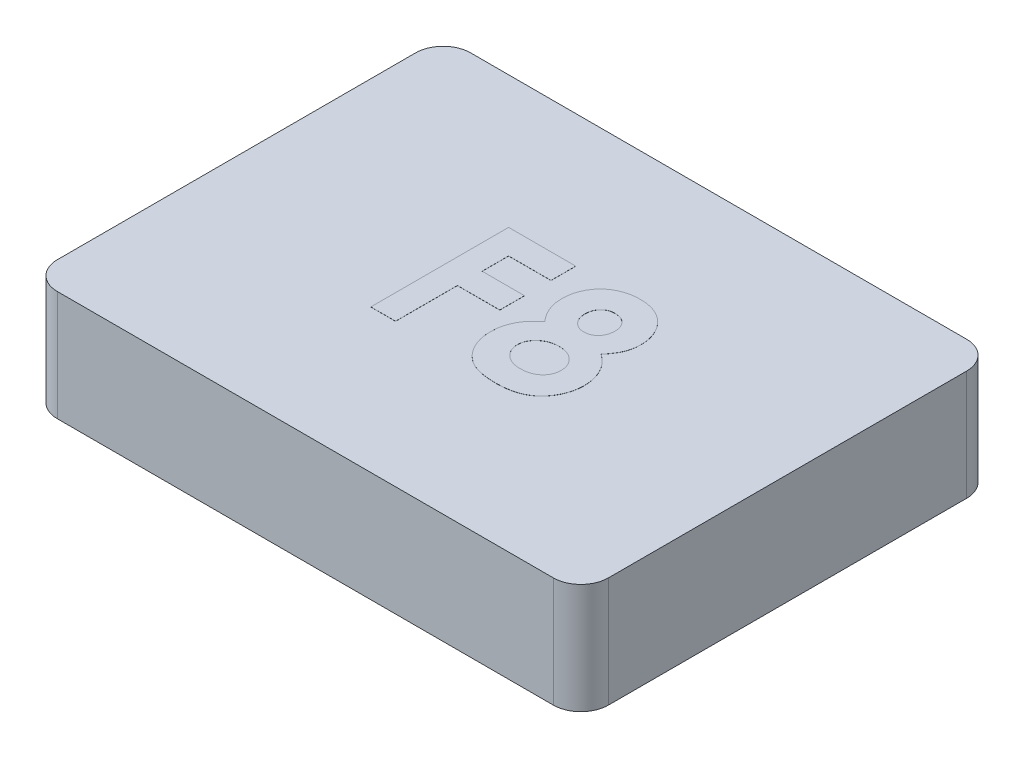
from build123d import *

# Parameters (mm, degrees)
SKETCH1_W           = 12.7
SKETCH1_H           = 9.525
BOSS_EXTRUDE1_DEPTH = 2.54
FILLET1_R           = 0.635
SHELL1_START        = 0.635
SHELL1_OUTLINE_W    = 1.905
SHELL1_OUTLINE_H    = 8.255
SHELL1_DEPTH        = 11.43
SKETCH2_R           = 2.54
BOSS_EXTRUDE2_DEPTH = 1.905
BOSS_EXTRUDE3_DEPTH = 0.00254


# Read off the part's stored shape, not the designer's step: Shell1
with BuildPart() as part:
    # Sketch1 → Boss-Extrude1 (new body)
    with BuildSketch(Plane(origin=(0, 0, 0), x_dir=(1, 0, 0), z_dir=(0, 1, 0))):
        with Locations((6.35, 4.7625)):
            Rectangle(SKETCH1_W, SKETCH1_H)
    extrude(amount=BOSS_EXTRUDE1_DEPTH)

    # Fillet1
    fillet1_edges = [part.edges().sort_by_distance(p)[0] for p in [
        (0, 1.27, -9.525),
        (12.7, 1.27, -9.525),
        (12.7, 1.27, 0),
        (0, 1.27, 0),
    ]]
    fillet(fillet1_edges, radius=FILLET1_R)

    # Shell1 outline → Shell1 (cut)
    with BuildSketch(Plane.YZ.offset(SHELL1_START)):
        with Locations((0.9525, -4.7625)):
            Rectangle(SHELL1_OUTLINE_W, SHELL1_OUTLINE_H)
    extrude(amount=SHELL1_DEPTH, mode=Mode.SUBTRACT)

    # Sketch2 → Boss-Extrude2 (add)
    with BuildSketch(Plane(origin=(0, 1.905, 0), x_dir=(-1, 0, 0), z_dir=(0, -1, 0))):
        with Locations(Location((-6.35, 4.7625, 0), (0, 0, 270))):
            Circle(SKETCH2_R)
    extrude(amount=BOSS_EXTRUDE2_DEPTH)

    # Sketch3 → Boss-Extrude3 (add)
    # profile 1 of 2: a face of its own
    with BuildSketch(Plane(origin=(0, 2.54, 0), x_dir=(1, 0, 0), z_dir=(0, 1, 0))):
        Polygon((4.557346154, 6.477), (6.104141026, 6.477), (6.104141026, 5.907128205), (5.127217949, 5.907128205), (5.127217949, 5.296551282), (6.104141026, 5.296551282), (6.104141026, 4.726679487), (5.127217949, 4.726679487), (5.127217949, 3.302), (4.557346154, 3.302), align=None)
    # profile 2 of 2: a face of its own
    with BuildSketch(Plane(origin=(0, 2.54, 0), x_dir=(1, 0, 0), z_dir=(0, 1, 0))):
        with BuildLine():
            add(Edge.make_bspline(
                [(8.152117788, 5.011615385), (8.185411662, 4.987826012), (8.251313882, 4.940737096), (8.338346608, 4.856375541), (8.413312127, 4.762269248), (8.47542322, 4.658995446), (8.525184754, 4.549092633), (8.560806462, 4.433735537), (8.583432962, 4.313941637), (8.585904452, 4.232382608), (8.587153846, 4.191152644)],
                knots=[0, 0, 0, 0, 1.013736912, 2.006600758, 2.994453809, 3.989973287, 4.987781207, 5.978959008, 6.978317308, 8, 8, 8, 8], degree=3))
            add(Edge.make_bspline(
                [(8.587153846, 4.191152644), (8.585646547, 4.14650785), (8.582657011, 4.057960631), (8.556225525, 3.928106148), (8.513790835, 3.80335344), (8.455795549, 3.685079461), (8.383080127, 3.576959714), (8.29832354, 3.481242926), (8.201418946, 3.400428905), (8.111198023, 3.345597114), (8.033541724, 3.309173392), (7.970873771, 3.285862941), (7.904700533, 3.26534135), (7.834549805, 3.248945961), (7.760434345, 3.236146669), (7.682459924, 3.22769404), (7.600575213, 3.221549495), (7.544733302, 3.220915055), (7.51610016, 3.220589744)],
                knots=[0, 0, 0, 0, 1.313679292, 2.605514271, 3.884962679, 5.186178731, 6.472827995, 7.711026938, 8.938935107, 10.174644318, 10.808706728, 11.462743532, 12.142127587, 12.847854939, 13.582806024, 14.355735269, 15.156897313, 16, 16, 16, 16], degree=3))
            add(Edge.make_bspline(
                [(7.51610016, 3.220589744), (7.485565755, 3.22100393), (7.425938082, 3.221812753), (7.338894962, 3.226703329), (7.256787585, 3.235719654), (7.179443718, 3.247588948), (7.106937773, 3.263295464), (7.039267602, 3.283210467), (6.976269809, 3.305885913), (6.899157201, 3.340411225), (6.811031474, 3.394329893), (6.7157835, 3.473292228), (6.632180148, 3.567338836), (6.559494951, 3.673829843), (6.502201739, 3.792110116), (6.459596799, 3.918467223), (6.434365649, 4.052558751), (6.431328101, 4.144404855), (6.429782051, 4.191152644)],
                knots=[0, 0, 0, 0, 0.886964665, 1.7320671, 2.531131818, 3.285397207, 4.004107883, 4.684213108, 5.332925796, 5.947568694, 7.135706876, 8.320776993, 9.52873045, 10.778999824, 12.05415135, 13.333578234, 14.642845846, 16, 16, 16, 16], degree=3))
            add(Edge.make_bspline(
                [(6.429782051, 4.191152644), (6.431194882, 4.2319324), (6.433971265, 4.312069557), (6.453858873, 4.429495836), (6.487960077, 4.540829844), (6.534752236, 4.646846641), (6.595089932, 4.747558024), (6.669329964, 4.842222955), (6.756531047, 4.931695445), (6.822657257, 4.984533521), (6.85654988, 5.011615385)],
                knots=[0, 0, 0, 0, 1.01821053, 2.000906977, 2.963938143, 3.919209931, 4.888045165, 5.887808425, 6.917407893, 8, 8, 8, 8], degree=3))
            add(Edge.make_bspline(
                [(6.85654988, 5.011615385), (6.835538251, 5.035849224), (6.794172682, 5.083558356), (6.740645229, 5.160342401), (6.695550604, 5.239506832), (6.65726312, 5.320409188), (6.628960036, 5.404442406), (6.60755638, 5.49028531), (6.595450493, 5.578812445), (6.593558306, 5.638482365), (6.592602564, 5.668621595)],
                knots=[0, 0, 0, 0, 1.061529281, 2.089831458, 3.092927091, 4.075998741, 5.048384512, 6.024008542, 7.00192825, 8, 8, 8, 8], degree=3))
            add(Edge.make_bspline(
                [(6.592602564, 5.668621595), (6.593869733, 5.709421227), (6.596369807, 5.789917329), (6.618512824, 5.907621637), (6.655275609, 6.019464189), (6.705288249, 6.125117526), (6.768796529, 6.222279049), (6.844258115, 6.309411214), (6.932733848, 6.383322406), (7.030933554, 6.44674147), (7.139349456, 6.497184406), (7.256952915, 6.532480594), (7.382323851, 6.554824943), (7.468725758, 6.557196971), (7.512920072, 6.558410256)],
                knots=[0, 0, 0, 0, 1.022455555, 2.017265428, 2.990720743, 3.968117071, 4.939886797, 5.893155559, 6.847550415, 7.820889576, 8.817530429, 9.83499769, 10.892607882, 12, 12, 12, 12], degree=3))
            add(Edge.make_bspline(
                [(7.512920072, 6.558410256), (7.556477872, 6.557194985), (7.641406462, 6.554825462), (7.764574172, 6.532629167), (7.879636197, 6.496546749), (7.985641059, 6.445038738), (8.082825189, 6.381497441), (8.16979721, 6.305012731), (8.245021995, 6.215710397), (8.309057434, 6.116035335), (8.360083839, 6.008649897), (8.39780748, 5.896033972), (8.419627279, 5.779072732), (8.422758376, 5.699661569), (8.424333333, 5.659717348)],
                knots=[0, 0, 0, 0, 1.094655142, 2.134348324, 3.136019022, 4.118575226, 5.088726318, 6.048298823, 7.020513804, 8.015920439, 9.020015034, 10.003048569, 10.995523219, 12, 12, 12, 12], degree=3))
            add(Edge.make_bspline(
                [(8.424333333, 5.659717348), (8.423574638, 5.631486932), (8.422085756, 5.576086853), (8.411077263, 5.494466901), (8.392540312, 5.416152447), (8.366695604, 5.339250953), (8.330762638, 5.261672577), (8.282136981, 5.181930777), (8.222990253, 5.096712264), (8.176539373, 5.040938489), (8.152117788, 5.011615385)],
                knots=[0, 0, 0, 0, 0.940746401, 1.846144481, 2.739104268, 3.619506754, 4.545839139, 5.581956076, 6.728711598, 8, 8, 8, 8], degree=3))
        make_face()
        with BuildLine():
            add(Edge.make_bspline(
                [(7.498927684, 5.988538462), (7.475464872, 5.987407337), (7.42982452, 5.985207049), (7.36470108, 5.965347019), (7.306152984, 5.932864527), (7.255516705, 5.888162225), (7.213992318, 5.833922679), (7.183474174, 5.771563237), (7.165376554, 5.701853484), (7.163460569, 5.653041394), (7.162474359, 5.627916466)],
                knots=[0, 0, 0, 0, 1.018099191, 1.980427864, 2.929421084, 3.909248076, 4.895556904, 5.880788387, 6.909183412, 8, 8, 8, 8], degree=3))
            add(Edge.make_bspline(
                [(7.162474359, 5.627916466), (7.16369263, 5.602576967), (7.166071422, 5.553099152), (7.184777948, 5.482050049), (7.216663739, 5.417659356), (7.260442714, 5.361271984), (7.313641259, 5.315216409), (7.373207321, 5.280041724), (7.439801498, 5.259961409), (7.486078061, 5.257238447), (7.509739984, 5.255846154)],
                knots=[0, 0, 0, 0, 1.07118507, 2.091592095, 3.082435519, 4.092579768, 5.090825648, 6.043203473, 6.999459622, 8, 8, 8, 8], degree=3))
            add(Edge.make_bspline(
                [(7.509739984, 5.255846154), (7.533849248, 5.256924942), (7.580818619, 5.259026624), (7.647579073, 5.279627967), (7.70772171, 5.312575617), (7.759224994, 5.359156306), (7.801885534, 5.415564099), (7.83295422, 5.481080076), (7.850836233, 5.554473276), (7.853223545, 5.605768386), (7.854461538, 5.63236859)],
                knots=[0, 0, 0, 0, 1.008803858, 1.965339183, 2.900766489, 3.864508618, 4.855158575, 5.849593072, 6.884859315, 8, 8, 8, 8], degree=3))
            add(Edge.make_bspline(
                [(7.854461538, 5.63236859), (7.853192229, 5.657476908), (7.85073743, 5.706035512), (7.833135579, 5.775749787), (7.800808899, 5.837135947), (7.758335813, 5.891038677), (7.705085945, 5.934507876), (7.643266749, 5.966475387), (7.573333435, 5.985016853), (7.524266689, 5.987339172), (7.498927684, 5.988538462)],
                knots=[0, 0, 0, 0, 1.065910571, 2.061433587, 3.023559535, 3.990682701, 4.956464619, 5.918590567, 6.925120432, 8, 8, 8, 8], degree=3))
        make_face(mode=Mode.SUBTRACT)
        with BuildLine():
            add(Edge.make_bspline(
                [(7.517372196, 4.685974359), (7.499542234, 4.685678266), (7.464399604, 4.68509467), (7.41273705, 4.678364936), (7.36316152, 4.668335968), (7.31573452, 4.654501289), (7.270695649, 4.635641141), (7.227663127, 4.612904884), (7.186785568, 4.586062683), (7.148669301, 4.555601858), (7.114221103, 4.522168201), (7.083169186, 4.48729798), (7.057788628, 4.450089706), (7.036652674, 4.411780194), (7.019669815, 4.372065862), (7.008442862, 4.330292696), (7.001214276, 4.287016998), (7.00017705, 4.257539347), (6.999653846, 4.242670072)],
                knots=[0, 0, 0, 0, 1.129580664, 2.226389355, 3.296443603, 4.333934503, 5.352185725, 6.386189251, 7.41493955, 8.447544828, 9.47401038, 10.455044306, 11.4018853, 12.322125673, 13.225630306, 14.132028716, 15.057747923, 16, 16, 16, 16], degree=3))
            add(Edge.make_bspline(
                [(6.999653846, 4.242670072), (6.999903214, 4.227162887), (7.000397805, 4.196406304), (7.007867902, 4.151514587), (7.018623522, 4.108219609), (7.033730134, 4.066926636), (7.053932358, 4.027659711), (7.07805418, 3.990037072), (7.106936718, 3.954322538), (7.139796832, 3.920707595), (7.176583584, 3.890380917), (7.216231641, 3.863662584), (7.258217342, 3.840106335), (7.303801068, 3.823140191), (7.351294672, 3.807611286), (7.401970524, 3.798190273), (7.455275128, 3.79125803), (7.491694264, 3.790731586), (7.510376002, 3.790461538)],
                knots=[0, 0, 0, 0, 0.973817353, 1.931446211, 2.852767904, 3.776304432, 4.688323523, 5.623710549, 6.581246645, 7.570897993, 8.57436511, 9.572506873, 10.574556662, 11.591826551, 12.624694332, 13.712108235, 14.826391851, 16, 16, 16, 16], degree=3))
            add(Edge.make_bspline(
                [(7.510376002, 3.790461538), (7.529260459, 3.790803842), (7.566060287, 3.791470882), (7.619854235, 3.797366257), (7.670733762, 3.806720502), (7.718638096, 3.820099252), (7.763748388, 3.837237963), (7.805459521, 3.859052151), (7.844723831, 3.883773696), (7.880279555, 3.912655854), (7.912744552, 3.944131378), (7.940717704, 3.978625875), (7.964502966, 4.015030128), (7.983688371, 4.053737483), (7.999169271, 4.094565228), (8.009788196, 4.137920457), (8.016377621, 4.183315958), (8.016977338, 4.214238245), (8.017282051, 4.22994972)],
                knots=[0, 0, 0, 0, 1.200705402, 2.339794563, 3.437264955, 4.487414319, 5.499029866, 6.500076882, 7.476298407, 8.444948224, 9.407950986, 10.347155707, 11.263432813, 12.167927724, 13.089546445, 14.03463663, 15.00140776, 16, 16, 16, 16], degree=3))
            add(Edge.make_bspline(
                [(8.017282051, 4.22994972), (8.016700229, 4.245866599), (8.015562967, 4.276978582), (8.009340037, 4.322922743), (7.997666456, 4.366478525), (7.982394002, 4.408656097), (7.962078131, 4.448582665), (7.936856417, 4.486173963), (7.908147916, 4.522361173), (7.874594022, 4.555533371), (7.837908056, 4.585864551), (7.798861692, 4.612886303), (7.757575198, 4.635771234), (7.713935642, 4.654478529), (7.667783575, 4.668343167), (7.619471139, 4.678364584), (7.569077584, 4.685096176), (7.534778761, 4.68567872), (7.517372196, 4.685974359)],
                knots=[0, 0, 0, 0, 1.011708178, 1.977538892, 2.938094892, 3.871441737, 4.823268678, 5.775953079, 6.743660653, 7.753304209, 8.767430709, 9.76505158, 10.765940967, 11.761741361, 12.775867861, 13.822051386, 14.89469657, 16, 16, 16, 16], degree=3))
        make_face(mode=Mode.SUBTRACT)
    extrude(amount=BOSS_EXTRUDE3_DEPTH)


solid = part.part
